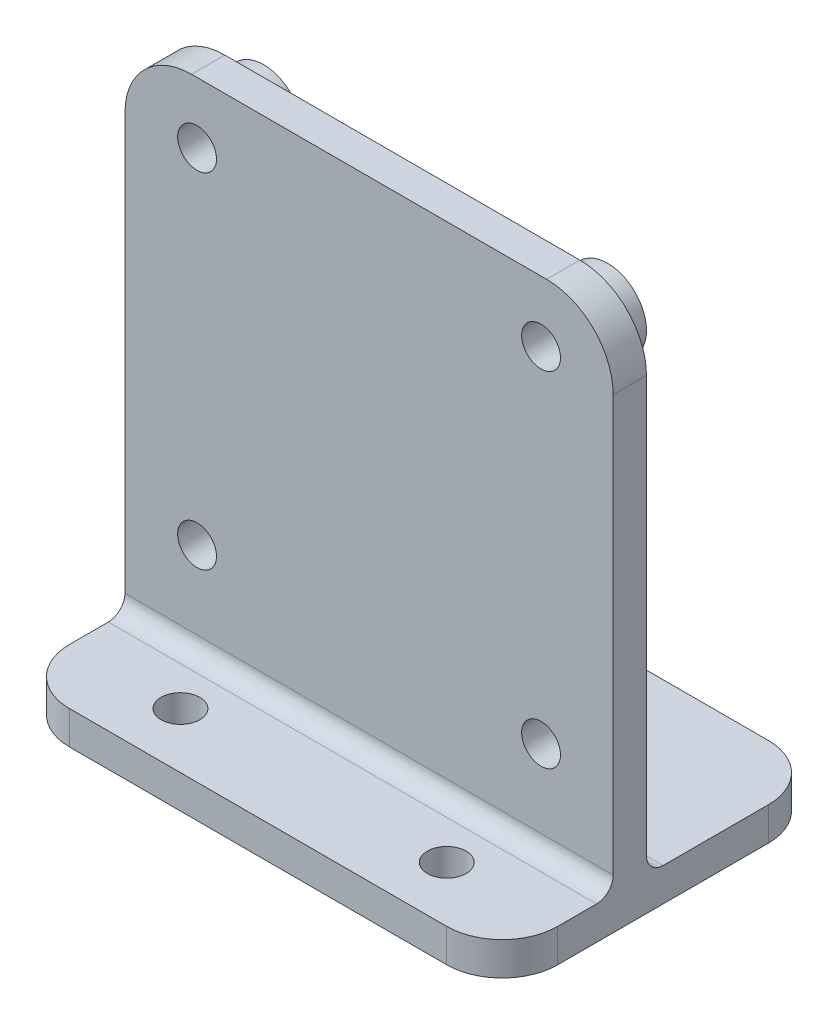
from build123d import *
from build123d.topology import SkipClean

# Parameters (mm, degrees)
SALIENTE_EXTRUIR1_DEPTH = 22
CROQUIS4_R              = 1.75
CORTAR_EXTRUIR1_DEPTH   = 56.172456897
CROQUIS5_R              = 1.75
CORTAR_EXTRUIR2_DEPTH   = 54.058929503
REDONDEO1_R             = 6
REDONDEO2_R             = 5
REDONDEO3_R             = 1.5
SALIENTE_EXTRUIR2_START = 3
CROQUIS6_R              = 3.5
CROQUIS6_R_2            = 1.75
SALIENTE_EXTRUIR2_DEPTH = 3


with BuildPart() as part:
    # Croquis3 → Saliente-Extruir1 (new, symmetric)
    with BuildSketch(Plane(origin=(0, 0, 0), x_dir=(0, 0, -1), z_dir=(1, 0, 0))):
        Polygon((-11.5, 0), (-11.5, 3), (-1.5, 3), (-1.5, 48), (1.5, 48), (1.5, 3), (17.5, 3), (17.5, 0), (0, 0), align=None)
    extrude(amount=SALIENTE_EXTRUIR1_DEPTH, both=True)

    # Croquis4 → Cortar-Extruir1 (cut, through all)
    with BuildSketch(Plane(origin=(0, 0, -1.5), x_dir=(-1, 0, 0), z_dir=(0, 0, -1))):
        with Locations((15.5, 42.5)):
            Circle(CROQUIS4_R)
        with Locations((-15.5, 11.5)):
            Circle(CROQUIS4_R)
    cortar_extruir1 = extrude(amount=-CORTAR_EXTRUIR1_DEPTH, mode=Mode.SUBTRACT)

    # Simetría1: Cortar-Extruir1 across plane
    add(cortar_extruir1.mirror(Plane(origin=(0, 0, 0), x_dir=(0, 0, 1), z_dir=(1, 0, 0))), mode=Mode.SUBTRACT)

    # Croquis5 → Cortar-Extruir2 (cut, through all)
    with BuildSketch(Plane(origin=(0, 3, 0), x_dir=(1, 0, 0), z_dir=(0, 1, 0))):
        with Locations((-12, -6.5)):
            Circle(CROQUIS5_R)
        with Locations((12, -6.5)):
            Circle(CROQUIS5_R)
    extrude(amount=-CORTAR_EXTRUIR2_DEPTH, mode=Mode.SUBTRACT)

    # Redondeo1
    redondeo1_edges = [part.edges().sort_by_distance(p)[0] for p in [
        (-22, 48, 0),
        (22, 48, 0),
    ]]
    fillet(redondeo1_edges, radius=REDONDEO1_R)

    # Redondeo2
    redondeo2_edges = [part.edges().sort_by_distance(p)[0] for p in [
        (22, 1.5, -17.5),
        (-22, 1.5, -17.5),
        (-22, 1.5, 11.5),
        (22, 1.5, 11.5),
    ]]
    fillet(redondeo2_edges, radius=REDONDEO2_R)

    # Redondeo3
    redondeo3_edges = [part.edges().sort_by_distance(p)[0] for p in [
        (0, 3, 1.5),
        (0, 3, -1.5),
    ]]
    fillet(redondeo3_edges, radius=REDONDEO3_R)

    # Croquis6 → Saliente-Extruir2 (add)
    # profile 1 of 2: a face of its own
    with SkipClean():  # the faces are left unmerged after this step: merging them gives an invalid solid
        with BuildSketch(Plane(origin=(0, 0, -1.5), x_dir=(-1, 0, 0), z_dir=(0, 0, -1)).offset(SALIENTE_EXTRUIR2_START)):
            with Locations((-15.5, 42.5)):
                Circle(CROQUIS6_R)
            with Locations((-15.5, 42.5)):
                Circle(CROQUIS6_R_2, mode=Mode.SUBTRACT)
        # profile 2 of 2: a face of its own
        with BuildSketch(Plane(origin=(0, 0, -1.5), x_dir=(-1, 0, 0), z_dir=(0, 0, -1)).offset(SALIENTE_EXTRUIR2_START)):
            with Locations((-15.5, 11.5)):
                Circle(CROQUIS6_R)
            with Locations((-15.5, 11.5)):
                Circle(CROQUIS6_R_2, mode=Mode.SUBTRACT)
        saliente_extruir2 = extrude(amount=-SALIENTE_EXTRUIR2_DEPTH)

    # Simetría2: Saliente-Extruir2 across plane
    add(saliente_extruir2.mirror(Plane(origin=(0, 0, 0), x_dir=(0, 0, 1), z_dir=(1, 0, 0))))


solid = part.part
